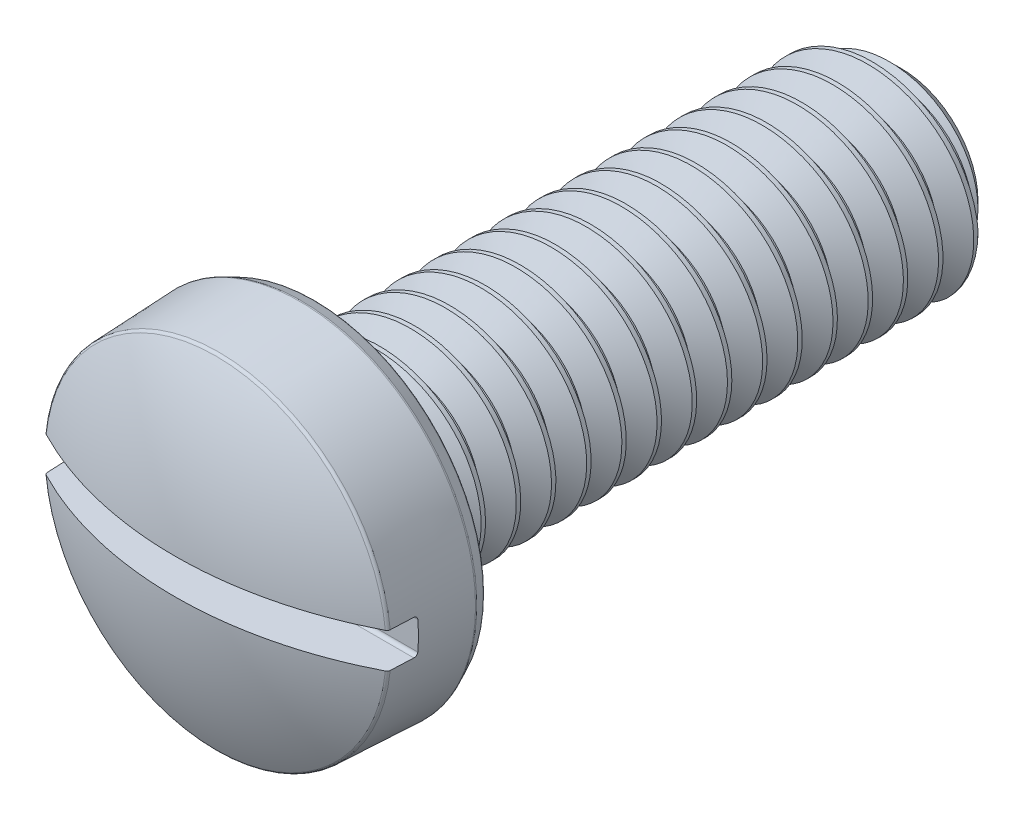
from build123d import *

# Parameters (mm, degrees)
CUT_EXTRUDE1_DEPTH      = 8.512655988
CUT_EXTRUDE1_DEPTH_BACK = 8.512655988
SKETCH3_W               = 1.2
SKETCH3_H               = 0.6
FILLET1_R               = 0.06
SPLIT1_START            = -6.2
SPLIT1_2_OUTLINE_R      = 1.75
SPLIT1_2_DEPTH          = 9.5
CUT_SWEEP1_PITCH        = 0.6
CUT_SWEEP1_TO           = 9.5


with BuildPart() as part:
    # Sketch2 → Revolve1 (revolve)
    with BuildSketch(Plane(origin=(0, 0, 0), x_dir=(0, 0, -1), z_dir=(1, 0, 0)), mode=Mode.PRIVATE) as revolve1_sk:
        with BuildLine():
            Line((-5.48, 2.937652174), (-4.052, 3))
            Line((-4.052, 3), (-3.8, 2.88249047))
            Line((-3.8, 2.88249047), (-3.8, 1.785))
            Line((-3.8, 1.785), (-3.3, 1.785))
            Line((-3.3, 1.785), (-3.3, 1.75))
            Line((-3.3, 1.75), (5.75, 1.75))
            Line((5.75, 1.75), (6.2, 1.3))
            Line((6.2, 1.3), (6.2, 0))
            Line((6.2, 0), (-6.2, 0))
            ThreePointArc((-6.2, 0), (-6.017375075, 1.512299598), (-5.48, 2.937652174))
        make_face()
    revolve(revolve1_sk.sketch.rotate(Axis((0, 0, 6.2), (0, 0, -1)), 90), axis=Axis((0, 0, 6.2), (0, 0, -1)))

    # Sketch3 → Cut-Extrude1 (cut, two sides: drawn at the far end of the back side and taken through both)
    with BuildSketch(Plane(origin=(0, 0, 0), x_dir=(0, 0, -1), z_dir=(1, 0, 0)).offset(-CUT_EXTRUDE1_DEPTH_BACK)):
        with Locations((-5.6, 0)):
            Rectangle(SKETCH3_W, SKETCH3_H)
    extrude(amount=CUT_EXTRUDE1_DEPTH + CUT_EXTRUDE1_DEPTH_BACK, mode=Mode.SUBTRACT)

    # Fillet1
    fillet1_edges = [part.edges().sort_by_distance(p)[0] for p in [
        (0, 0.3, 5),
        (0, -0.3, 5),
        (0, -2.937652174, 5.48),
        (0, 2.937652174, 5.48),
        (-2.88249047, 0, 3.8),
        (-3, 0, 4.052),
        (-1.785, 0, 3.8),
    ]]
    fillet(fillet1_edges, radius=FILLET1_R)

    # Split1 2 outline → Split1 2 (cut)
    with BuildSketch(Plane.XY.offset(SPLIT1_START)):
        Circle(SPLIT1_2_OUTLINE_R)
    extrude(amount=SPLIT1_2_DEPTH, mode=Mode.SUBTRACT)



with BuildPart() as body_2:
    # Split1: read off the stored shape, not the designer's step
    # Split1 outline → Split1 (revolve)
    with BuildSketch(Plane.XZ):
        Polygon((1.75, 3.3), (0, 3.3), (0, -6.2), (1.3, -6.2), (1.75, -5.75), align=None)
    revolve(axis=Axis((0, 0, 0), (0, 0, 1)))

    # Cut-Sweep1: arcs per turn and ends read off the stored shape
    # Cut-Sweep1: the profile of Sketch5 profile screwed along a right-hand helix through 17.666667 turns, 6 arcs to a turn; built about Z, then put on its axis
    cut_sweep1_z = Axis((0, 0, 0), (0, 0, 1))
    cut_sweep1_corners = [(1.7503, 0, 0.000173205), (1.7503, 0, -0.525173205), (1.360288568, 0, -0.3), (1.360288568, 0, -0.225)]
    with BuildLine(mode=Mode.PRIVATE) as cut_sweep1_profile:
        Line(cut_sweep1_corners[0], cut_sweep1_corners[1])
        Line(cut_sweep1_corners[1], cut_sweep1_corners[2])
        Line(cut_sweep1_corners[2], cut_sweep1_corners[3])
        Line(cut_sweep1_corners[3], cut_sweep1_corners[0])
    cut_sweep1_cap = Face(cut_sweep1_profile.wire())
    cut_sweep1_turn_angles = [0, 30, 60, 90, 120, 150, 180, 210, 240, 270, 300, 330, 360]
    cut_sweep1_turn_weights = [1, 0.8660254037844387, 1, 0.8660254037844387, 1, 0.8660254037844387, 1, 0.8660254037844387, 1, 0.8660254037844387, 1, 0.8660254037844387, 1]
    cut_sweep1_turn_rails = [Edge.make_bspline([Vector(p[0], p[1], 0).rotate(cut_sweep1_z, cut_sweep1_turn_angles[k]) / cut_sweep1_turn_weights[k] + Vector(0, 0, p[2] + CUT_SWEEP1_PITCH * cut_sweep1_turn_angles[k] / 360) for k in range(13)], [0, 0, 0, 1, 1, 2, 2, 3, 3, 4, 4, 5, 5, 6, 6, 6], 2, cut_sweep1_turn_weights) for p in cut_sweep1_corners]
    cut_sweep1_turn_sides = [Face.make_surface_from_curves(cut_sweep1_turn_rails[p[0]], cut_sweep1_turn_rails[p[1]]) for p in [(0, 1), (1, 2), (2, 3), (3, 0)]]
    cut_sweep1_last_angles = [6120, 6150, 6180, 6210, 6240, 6270, 6300, 6330, 6360]
    cut_sweep1_last_weights = [1, 0.8660254037844387, 1, 0.8660254037844387, 1, 0.8660254037844387, 1, 0.8660254037844506, 1]
    cut_sweep1_last_rails = [Edge.make_bspline([Vector(p[0], p[1], 0).rotate(cut_sweep1_z, cut_sweep1_last_angles[k]) / cut_sweep1_last_weights[k] + Vector(0, 0, p[2] + CUT_SWEEP1_PITCH * cut_sweep1_last_angles[k] / 360) for k in range(9)], [0, 0, 0, 1, 1, 2, 2, 3, 3, 4, 4, 4], 2, cut_sweep1_last_weights) for p in cut_sweep1_corners]
    cut_sweep1_last_sides = [Face.make_surface_from_curves(cut_sweep1_last_rails[p[0]], cut_sweep1_last_rails[p[1]]) for p in [(0, 1), (1, 2), (2, 3), (3, 0)]]
    cut_sweep1 = Plane(origin=(0, 0, -6.2), x_dir=(0, 1, 0), z_dir=(0, 0, 1)) * split(Solid(Shell([*[p.moved(Location((0, 0, CUT_SWEEP1_PITCH * i))) for i in range(17) for p in cut_sweep1_turn_sides], *cut_sweep1_last_sides, cut_sweep1_cap, cut_sweep1_cap.rotate(cut_sweep1_z, 6360).moved(Location((0, 0, CUT_SWEEP1_PITCH * 6360 / 360)))])), bisect_by=Plane.XY.offset(CUT_SWEEP1_TO), keep=Keep.BOTTOM, mode=Mode.PRIVATE)
    add(cut_sweep1, mode=Mode.SUBTRACT)


with BuildPart() as part_1:
    add(part.part)

    add(body_2.part)  # Boss-Extrude1 merges body 2
    # Boss-Extrude1: read off the stored shape, not the designer's step
    # Boss-Extrude1 outline → Boss-Extrude1 (revolve)
    with BuildSketch(Plane.XZ):
        Polygon((1.360282293, 3.3), (1.360282293, 3.054789118), (1.785, 3.3), align=None)
    revolve(axis=Axis((0, 0, 0), (0, 0, 1)))


solid = part_1.part
